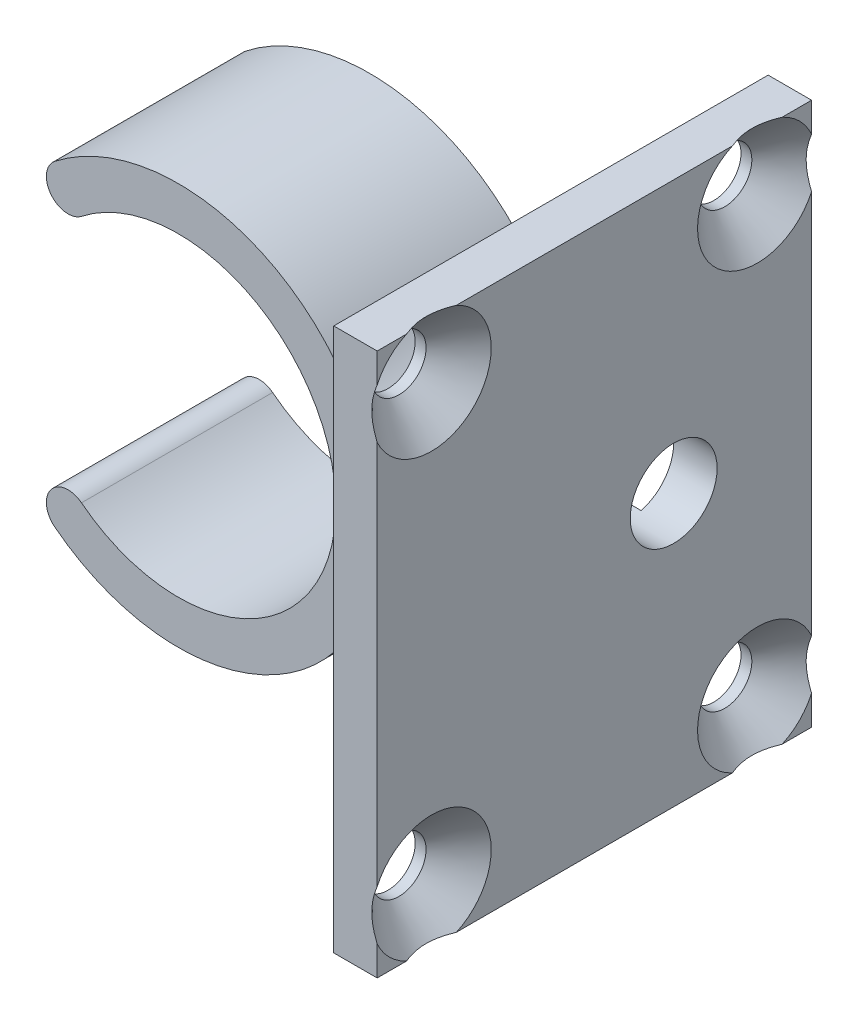
from build123d import *

# Parameters (mm, degrees)
EXTRUDE_5_DEPTH        = 4.8
EXTRUDE_5_DEPTH_BACK   = 4
EXTRUDE_START          = -4
EXTRUDE_902_DEPTH      = 8.8
SKETCH_8_W             = 20
SKETCH_8_H             = 25
SKETCH_8_R             = 1.25
EXTRUDE_2674_DEPTH     = 2
CHAMFER_2_SIZE         = 1.5
CUT_EXTRUDE_2965_REACH = 28.131
SKETCH_9_R             = 2


with BuildPart() as part:
    # Эскиз1 → Выталкивающая часть (С ПАЗАМИ В ОБЕ СТОРОНЫ ВЫДАВИТЬ НА 5ММ) (new, two sides: drawn at the far end of the back side and taken through both)
    with BuildSketch(Plane.XY.offset(-EXTRUDE_5_DEPTH_BACK)):
        with BuildLine():
            ThreePointArc((-4.464770012, -5.712121212), (7.25, 0), (-4.464770012, 5.712121212))
            ThreePointArc((-4.464770012, 5.712121212), (-5.868479146, 5.884169654), (-5.696430705, 7.287878788))
            ThreePointArc((-5.696430705, 7.287878788), (9.25, 0), (-5.696430705, -7.287878788))
            ThreePointArc((-5.696430705, -7.287878788), (-5.868479146, -5.884169654), (-4.464770012, -5.712121212))
        make_face()
    extrude(amount=EXTRUDE_5_DEPTH + EXTRUDE_5_DEPTH_BACK)

    # Эскиз2 → Extrude 902 (add)
    with BuildSketch(Plane.XY.offset(EXTRUDE_START)):
        with BuildLine():
            Line((12.5, 3.75), (12.5, -3.75))
            ThreePointArc((12.5, -3.75), (9.598284348, -4.027802018), (7.246080423, -5.749505936))
            ThreePointArc((7.246080423, -5.749505936), (9.25, 0), (7.246080423, 5.749505936))
            ThreePointArc((7.246080423, 5.749505936), (9.598284348, 4.027802018), (12.5, 3.75))
        make_face()
    extrude(amount=EXTRUDE_902_DEPTH)

    # Эскиз8 → Extrude 2674 (add)
    with BuildSketch(Plane(origin=(12.5, 0, 0), x_dir=(0, 0, -1), z_dir=(1, 0, 0))):
        with Locations((-0.15, 0)):
            Rectangle(SKETCH_8_W, SKETCH_8_H)
        with Locations((-7.65, 10)):
            Circle(SKETCH_8_R, mode=Mode.SUBTRACT)
        with Locations((-7.65, -10)):
            Circle(SKETCH_8_R, mode=Mode.SUBTRACT)
        with Locations((7.35, -10)):
            Circle(SKETCH_8_R, mode=Mode.SUBTRACT)
        with Locations((7.35, 10)):
            Circle(SKETCH_8_R, mode=Mode.SUBTRACT)
    extrude(amount=EXTRUDE_2674_DEPTH)

    # Фаска2
    # the kernel refuses this chamfer: 1.5 mm, written as the material it takes off along each edge
    with BuildSketch(Plane(origin=(14.5, -10, -7.35), x_dir=(0, 0, -1), z_dir=(0, -1, 0))) as chamfer_2_piece_1:
        Polygon((1.25 + CHAMFER_2_SIZE, 0), (1.25, -CHAMFER_2_SIZE), (1.25, 0), align=None)
    revolve(axis=Axis((14.5, -10, -7.35), (1, 0, 0)), mode=Mode.SUBTRACT)
    with BuildSketch(Plane(origin=(14.5, 10, 7.65), x_dir=(0, 0, -1), z_dir=(0, -1, 0))) as chamfer_2_piece_2:
        Polygon((1.25 + CHAMFER_2_SIZE, 0), (1.25, -CHAMFER_2_SIZE), (1.25, 0), align=None)
    revolve(axis=Axis((14.5, 10, 7.65), (1, 0, 0)), mode=Mode.SUBTRACT)
    with BuildSketch(Plane(origin=(14.5, -10, 7.65), x_dir=(0, 0, -1), z_dir=(0, -1, 0))) as chamfer_2_piece_3:
        Polygon((1.25 + CHAMFER_2_SIZE, 0), (1.25, -CHAMFER_2_SIZE), (1.25, 0), align=None)
    revolve(axis=Axis((14.5, -10, 7.65), (1, 0, 0)), mode=Mode.SUBTRACT)
    with BuildSketch(Plane(origin=(14.5, 10, -7.35), x_dir=(0, 0, -1), z_dir=(0, -1, 0))) as chamfer_2_piece_4:
        Polygon((1.25 + CHAMFER_2_SIZE, 0), (1.25, -CHAMFER_2_SIZE), (1.25, 0), align=None)
    revolve(axis=Axis((14.5, 10, -7.35), (1, 0, 0)), mode=Mode.SUBTRACT)

    # Эскиз9 → Cut-Extrude 2965 (cut, up to next)
    with BuildSketch(Plane(origin=(14.5, 0, 0), x_dir=(0, 0, -1), z_dir=(1, 0, 0)), mode=Mode.PRIVATE) as cut_extrude_2965_sk1:
        with Locations((3.5, 0)):
            Circle(SKETCH_9_R)
    cut_extrude_2965_tool1 = extrude(cut_extrude_2965_sk1.sketch, amount=-CUT_EXTRUDE_2965_REACH, mode=Mode.PRIVATE) & part.part
    add(cut_extrude_2965_tool1.solids().sort_by_distance((14.5, 0, -3.5))[0], mode=Mode.SUBTRACT)


solid = part.part
